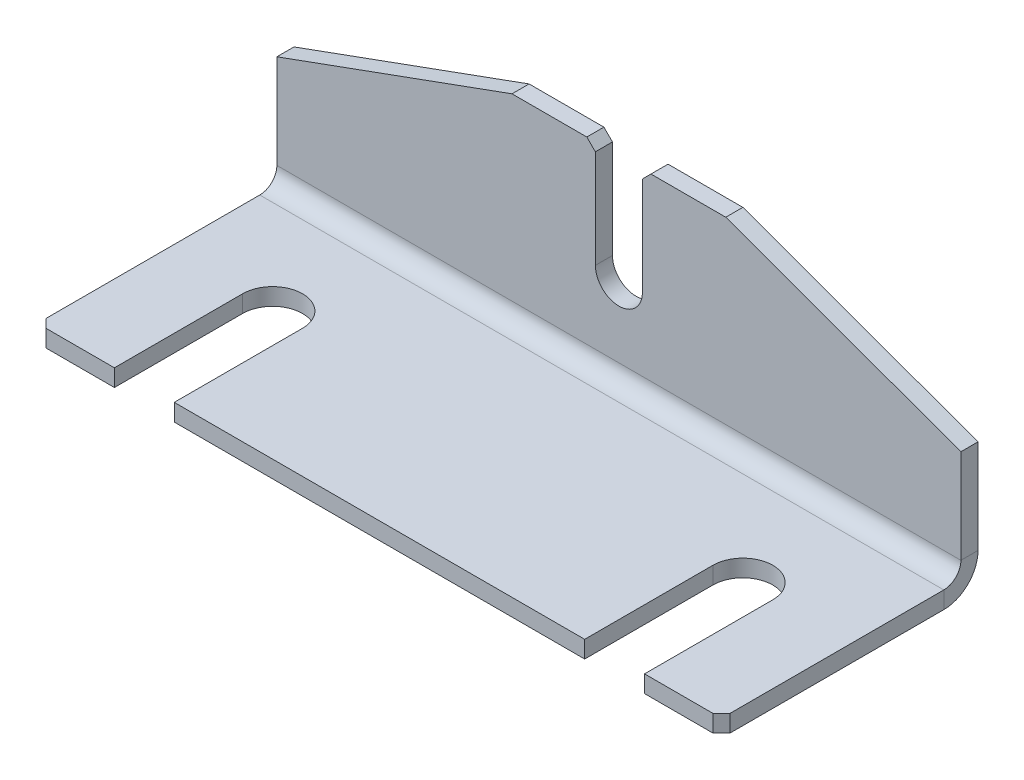
from build123d import *

# Parameters (mm, degrees)
SKETCH2_W                    = 160
SKETCH2_H                    = 60
BASE_FLANGE1_DEPTH           = 4
CUT_EXTRUDE1_DEPTH           = 86.533619121
BREAK_CORNER1_START          = -77.781745931
BREAK_CORNER1_OUTLINE_W      = 114.367532368
BREAK_CORNER1_OUTLINE_H      = 6
BREAK_CORNER1_DEPTH          = 1.414213563
BREAK_CORNER1_START_2        = 33.941125497
BREAK_CORNER1_2_OUTLINE_W    = 1.632467632
BREAK_CORNER1_2_OUTLINE_H    = 6
BREAK_CORNER1_2_DEPTH        = 2.828427125
EDGE_FLANGE1_STRIP_W         = 24
EDGE_FLANGE1_STRIP_H         = 4
EDGE_FLANGE1_STRIP_CUT_DEPTH = 160
EDGE_FLANGE1_DEPTH           = 160
CUT_EXTRUDE2_DEPTH           = 108.944430148
BREAK_CORNER2_START          = -37.830212793
BREAK_CORNER2_OUTLINE_W      = 11.776388924
BREAK_CORNER2_OUTLINE_H      = 7
BREAK_CORNER2_DEPTH          = 10.606601717


# Read off the part's stored shape, not the designer's step: Break-Corner1, Break-Corner2
# Sheet-metal steps are written as plain solids
with BuildPart() as part:
    # Sketch2 → Base-Flange1 (new body)
    with BuildSketch(Plane(origin=(0, 0, 0), x_dir=(1, 0, 0), z_dir=(0, 1, 0))):
        Rectangle(SKETCH2_W, SKETCH2_H)
    extrude(amount=-BASE_FLANGE1_DEPTH)

    # Sketch8 → Cut-Extrude1 (cut, through all)
    with BuildSketch(Plane(origin=(0, 0, 0), x_dir=(1, 0, 0), z_dir=(0, 1, 0))):
        with BuildLine():
            Line((-48, 0), (-48, -31.405477162))
            Line((-48, -31.405477162), (-62, -31.405477162))
            Line((-62, -31.405477162), (-62, 0))
            ThreePointArc((-62, 0), (-55, 7), (-48, 0))
        make_face()
        with BuildLine():
            Line((62, -31.405477162), (62, 0))
            ThreePointArc((62, 0), (55, 7), (48, 0))
            Line((48, 0), (48, -31.405477162))
            Line((48, -31.405477162), (62, -31.405477162))
        make_face()
    extrude(amount=-CUT_EXTRUDE1_DEPTH, mode=Mode.SUBTRACT)

    # Break-Corner1 outline → Break-Corner1 (cut)
    with BuildSketch(Plane(origin=(0, 0, 0), x_dir=(0.707106781186548, 0, 0.707106781186547), z_dir=(0.707106781186547, 0, -0.707106781186548)).offset(BREAK_CORNER1_START)):
        with Locations((19.183766184, 2)):
            Rectangle(BREAK_CORNER1_OUTLINE_W, BREAK_CORNER1_OUTLINE_H)
    extrude(amount=BREAK_CORNER1_DEPTH, mode=Mode.SUBTRACT)

    # Break-Corner1 2 outline → Break-Corner1 2 (cut)
    with BuildSketch(Plane(origin=(0, 0, 0), x_dir=(0.707106781186548, 0, 0.707106781186547), z_dir=(0.707106781186547, 0, -0.707106781186548)).offset(BREAK_CORNER1_START_2)):
        with Locations((77.183766184, 2)):
            Rectangle(BREAK_CORNER1_2_OUTLINE_W, BREAK_CORNER1_2_OUTLINE_H)
    extrude(amount=BREAK_CORNER1_2_DEPTH, mode=Mode.SUBTRACT)

    # Edge-Flange1 strip (across the edge) → Edge-Flange1 strip cut (cut)
    with BuildSketch(Plane(origin=(80, 0, -30), x_dir=(0, 0, 1), z_dir=(-1, 0, 0))):
        with Locations((-4, -2)):
            Rectangle(EDGE_FLANGE1_STRIP_W, EDGE_FLANGE1_STRIP_H)
    extrude(amount=EDGE_FLANGE1_STRIP_CUT_DEPTH, mode=Mode.SUBTRACT)

    # Edge-Flange1 section (across the edge) → Edge-Flange1 (add)
    with BuildSketch(Plane(origin=(80, 0, -30), x_dir=(0, 0, 1), z_dir=(-1, 0, 0))):
        with BuildLine():
            Line((0, 4), (0, 46))
            Line((0, 46), (4, 46))
            Line((4, 46), (4, 4))
            ThreePointArc((4, 4), (5.171572875, 1.171572875), (8, 0))
            Line((8, 0), (8, -4))
            ThreePointArc((8, -4), (2.343145751, -1.656854249), (0, 4))
        make_face()
    extrude(amount=EDGE_FLANGE1_DEPTH)

    # Sketch14 → Cut-Extrude2 (cut, through all)
    with BuildSketch(Plane.XY.offset(-26)):
        with BuildLine():
            Line((5.5, 21), (5.5, 51.754335402))
            Line((5.5, 51.754335402), (-5.5, 51.754335402))
            Line((-5.5, 51.754335402), (-5.5, 21))
            ThreePointArc((-5.5, 21), (0, 15.5), (5.5, 21))
        make_face()
        Polygon((80, 26), (80, 46), (25, 46), align=None)
        Polygon((-80, 26), (-25, 46), (-80, 46), align=None)
    extrude(amount=-CUT_EXTRUDE2_DEPTH, mode=Mode.SUBTRACT)

    # Break-Corner2 outline → Break-Corner2 (cut)
    with BuildSketch(Plane(origin=(0, 0, 0), x_dir=(0.707106781186546, 0.707106781186549, 0), z_dir=(0.707106781186549, -0.707106781186546, 0)).offset(BREAK_CORNER2_START)):
        with Locations((33.111805538, -28.5)):
            Rectangle(BREAK_CORNER2_OUTLINE_W, BREAK_CORNER2_OUTLINE_H)
    extrude(amount=BREAK_CORNER2_DEPTH, mode=Mode.SUBTRACT)


solid = part.part
